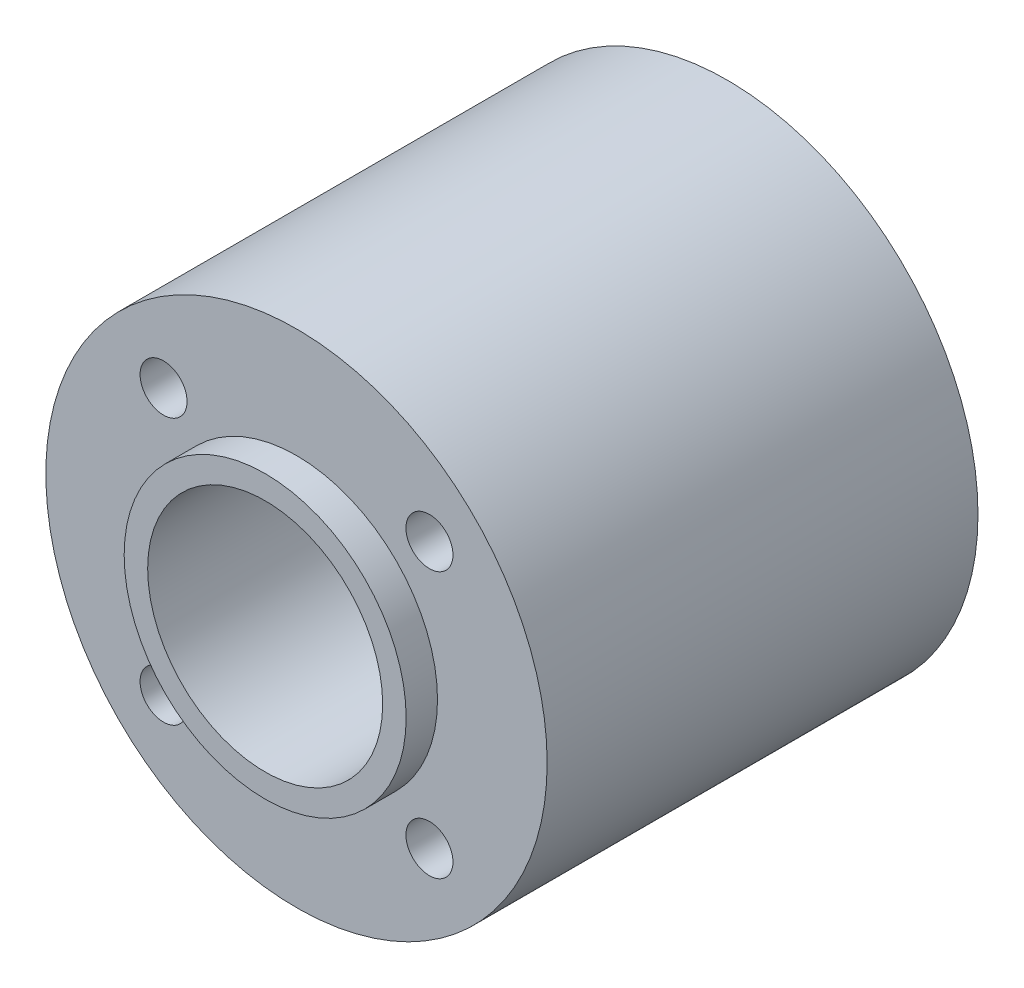
from build123d import *

# Parameters (mm, degrees)
ESQUISSE1_R             = 16
BOSS_EXTRU_1_DEPTH      = 13.75
ESQUISSE2_R             = 1.5
ENL_V_MAT_EXTRU_1_DEPTH = 36.612497806
ESQUISSE3_R             = 7.5
ENL_V_MAT_EXTRU_2_DEPTH = 36.612497806
BOSS_EXTRU_2_START      = 2
ESQUISSE4_R             = 9
ESQUISSE4_R_2           = 7.5
BOSS_EXTRU_2_DEPTH      = 2


with BuildPart() as part:
    # Esquisse1 → Boss.-Extru.1 (new, symmetric)
    with BuildSketch(Plane.XY):
        Circle(ESQUISSE1_R)
    extrude(amount=BOSS_EXTRU_1_DEPTH, both=True)

    # Esquisse2 → Enlèv. mat.-Extru.1 (cut, through all)
    with BuildSketch(Plane.XY.offset(13.75)):
        with Locations((-8.485281374, 8.485281374)):
            Circle(ESQUISSE2_R)
        with Locations((8.485281374, 8.485281374)):
            Circle(ESQUISSE2_R)
        with Locations((8.485281374, -8.485281374)):
            Circle(ESQUISSE2_R)
        with Locations((-8.485281374, -8.485281374)):
            Circle(ESQUISSE2_R)
    extrude(amount=-ENL_V_MAT_EXTRU_1_DEPTH, mode=Mode.SUBTRACT)

    # Esquisse3 → Enlèv. mat.-Extru.2 (cut, through all)
    with BuildSketch(Plane.XY.offset(13.75)):
        Circle(ESQUISSE3_R)
    extrude(amount=-ENL_V_MAT_EXTRU_2_DEPTH, mode=Mode.SUBTRACT)

    # Esquisse4 → Boss.-Extru.2 (add)
    with BuildSketch(Plane.XY.offset(13.75).offset(BOSS_EXTRU_2_START)):
        Circle(ESQUISSE4_R)
        Circle(ESQUISSE4_R_2, mode=Mode.SUBTRACT)
    boss_extru_2 = extrude(amount=-BOSS_EXTRU_2_DEPTH)

    # Symétrie1: Boss.-Extru.2 across plane
    add(boss_extru_2.mirror(Plane.XY))


solid = part.part
